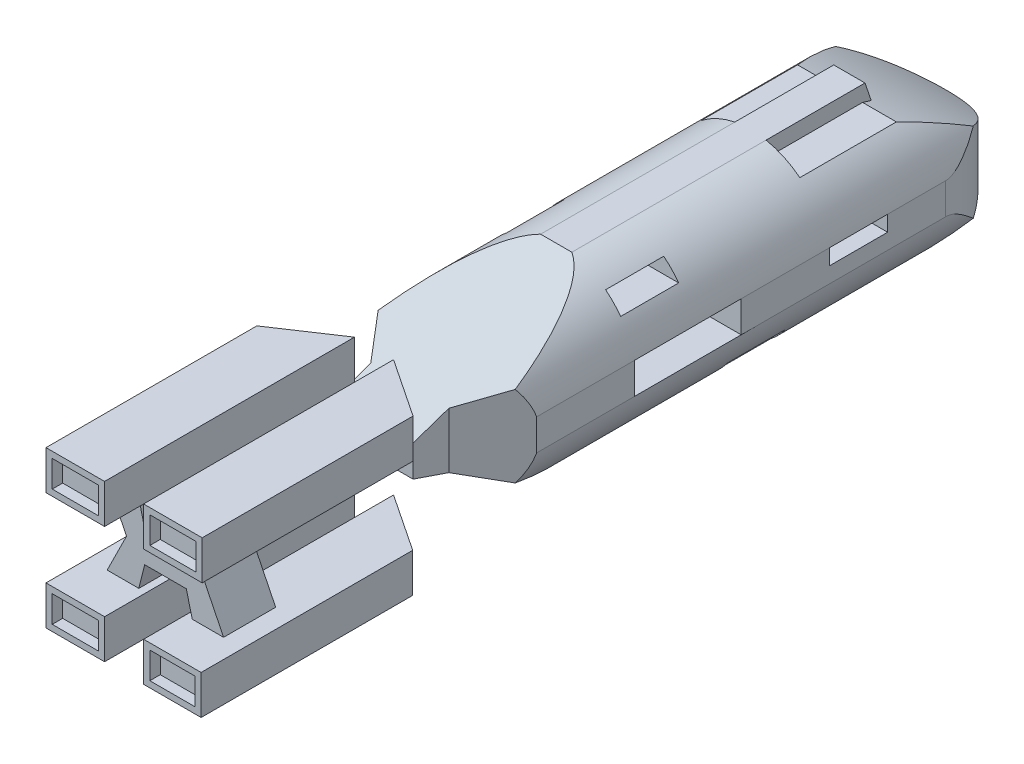
from build123d import *

# Parameters (mm, degrees)
SKETCH1_W            = 150000
SKETCH1_H            = 750000
BOSS_EXTRUDE1_DEPTH  = 150000
CUT_EXTRUDE2_DEPTH   = 430843.198490352
CUT_EXTRUDE3_DEPTH   = 410792.918128875
SKETCH5_OUTSIDE_W    = 305886.572
SKETCH5_OUTSIDE_H    = 305886.572
SKETCH5_OUTSIDE_W_2  = 56250
SKETCH5_OUTSIDE_H_2  = 37500
SKETCH5_OUTSIDE_W_3  = 55219.950582036
CUT_EXTRUDE4_DEPTH   = 200000
BOSS_EXTRUDE2_DEPTH  = 50000
BOSS_EXTRUDE3_DEPTH  = 280000
CUT_EXTRUDE5_DEPTH   = 430843.198490352
CUT_EXTRUDE7_DEPTH   = 38976
SKETCH10_OUTSIDE_W   = 305886.572
SKETCH10_OUTSIDE_H   = 305886.572
SKETCH10_OUTSIDE_R   = 76485.292703892
CUT_EXTRUDE8_DEPTH   = 496230
CUT_EXTRUDE10_DEPTH  = 40000
SKETCH14_W           = 55219.950582036
SKETCH14_H           = 37500
SKETCH14_W_2         = 56250
BOSS_EXTRUDE5_DEPTH  = 40000
CUT_EXTRUDE12_DEPTH  = 447605.736346752
SKETCH20_W           = 102625
SKETCH20_H           = 30000.000000002
SKETCH20_W_2         = 55750
SKETCH20_H_2         = 15000.000000001
CUT_EXTRUDE15_DEPTH  = 20000
SKETCH21_W           = 102625
SKETCH21_H           = 30000.000000002
CUT_EXTRUDE16_DEPTH  = 460028.17311052
SKETCH22_W           = 30000
SKETCH22_H           = 100000
BOSS_EXTRUDE8_DEPTH  = 39634
CUT_EXTRUDE17_DEPTH  = 39634
SKETCH24_W           = 55750
SKETCH24_H           = 15000
CUT_EXTRUDE18_DEPTH  = 55000
SKETCH25_W           = 45000
SKETCH25_H           = 95000
CUT_EXTRUDE19_DEPTH  = 15000
SKETCH27_W           = 65836.596516098
SKETCH27_H           = 105204.254354878
CUT_EXTRUDE22_DEPTH  = 50000
CUT_EXTRUDE24_START  = -236000
SKETCH31_W           = 44250
SKETCH31_H           = 25500
SKETCH31_W_2         = 43219.950582036
CUT_EXTRUDE24_DEPTH  = 236000
SKETCH33_W           = 44250
SKETCH33_H           = 25500
SKETCH33_W_2         = 43219.950582036
BOSS_EXTRUDE12_DEPTH = 200000
SKETCH34_W           = 44250
SKETCH34_H           = 25500
SKETCH34_W_2         = 43219.950582036
CUT_EXTRUDE25_DEPTH  = 10000
SKETCH35_W           = 30000
SKETCH35_H           = 120000
CUT_EXTRUDE26_DEPTH  = 20000
SKETCH36_R           = 5000
BOSS_EXTRUDE13_DEPTH = 67198
SKETCH37_W           = 10000
SKETCH37_H           = 10000
BOSS_EXTRUDE14_DEPTH = 11113
SKETCH38_R           = 4000
CUT_EXTRUDE27_DEPTH  = 86238
CUT_EXTRUDE28_DEPTH  = 10


with BuildPart() as part:
    # Sketch1 → Boss-Extrude1 (new body)
    with BuildSketch(Plane(origin=(0, 0, 0), x_dir=(1, 0, 0), z_dir=(0, 1, 0))):
        Rectangle(SKETCH1_W, SKETCH1_H)
    extrude(amount=BOSS_EXTRUDE1_DEPTH)

    # Sketch3 → Cut-Extrude2 (cut, through all)
    with BuildSketch(Plane(origin=(75000, 0, 0), x_dir=(0, 0, -1), z_dir=(1, 0, 0))):
        with BuildLine():
            Line((187500, 150000), (375000, 150000))
            Line((375000, 150000), (375000, 90000))
            ThreePointArc((375000, 90000), (285431.03929469, 133065.747795905), (187500, 150000))
        make_face()
        with BuildLine():
            Line((375000, 60000), (375000, 0))
            Line((375000, 0), (187500, 0))
            ThreePointArc((187500, 0), (285431.03929469, 16934.252204095), (375000, 60000))
        make_face()
    extrude(amount=-CUT_EXTRUDE2_DEPTH, mode=Mode.SUBTRACT)

    # Sketch4 → Cut-Extrude3 (cut, through all)
    with BuildSketch(Plane(origin=(0, 150000, 0), x_dir=(1, 0, 0), z_dir=(0, 1, 0))):
        Polygon((-75000, -93750), (-37500, -140625), (-37500, -187500), (-75000, -187500), align=None)
        Polygon((75000, -93750), (37500, -140625), (37500, -187500), (75000, -187500), align=None)
    extrude(amount=-CUT_EXTRUDE3_DEPTH, mode=Mode.SUBTRACT)

    # Sketch5 outside → Cut-Extrude4 (cut)
    with BuildSketch(Plane.XY.offset(375000)):
        with Locations((0, 75000)):
            Rectangle(SKETCH5_OUTSIDE_W, SKETCH5_OUTSIDE_H)
        with Locations((-46875, 131250)):
            Rectangle(SKETCH5_OUTSIDE_W_2, SKETCH5_OUTSIDE_H_2, mode=Mode.SUBTRACT)
        with Locations((46875, 131250)):
            Rectangle(SKETCH5_OUTSIDE_W_2, SKETCH5_OUTSIDE_H_2, mode=Mode.SUBTRACT)
        with Locations((-46875, 18750)):
            Rectangle(SKETCH5_OUTSIDE_W_2, SKETCH5_OUTSIDE_H_2, mode=Mode.SUBTRACT)
        with Locations((46359.975291018, 18750)):
            Rectangle(SKETCH5_OUTSIDE_W_3, SKETCH5_OUTSIDE_H_2, mode=Mode.SUBTRACT)
    extrude(amount=-CUT_EXTRUDE4_DEPTH, mode=Mode.SUBTRACT)

    # Sketch6 → Boss-Extrude2 (add)
    with BuildSketch(Plane.XY.offset(375000)):
        Polygon((60164.962936527, 28125), (37113.731468264, 75000), (60937.5, 121875), (32812.5, 140625), (19742.487645509, 90000), (-20257.512354491, 90000), (-32812.5, 140625), (-60937.5, 121875), (-37628.756177245, 75000), (-60937.5, 28125), (-32812.5, 9375), (-20257.512354491, 60000), (19742.487645509, 60000), (32554.987645509, 9375), align=None)
    extrude(amount=-BOSS_EXTRUDE2_DEPTH)

    # Sketch7 → Boss-Extrude3 (add)
    with BuildSketch(Plane.XY.offset(375000)):
        Polygon((-20257.512354491, 90000), (-37628.756177245, 75000), (-20257.512354491, 60000), (19742.487645509, 60000), (37113.731468264, 75000), (19742.487645509, 90000), align=None)
    extrude(amount=-BOSS_EXTRUDE3_DEPTH)

    # Sketch8 → Cut-Extrude5 (cut, through all)
    with BuildSketch(Plane(origin=(75000, 0, 0), x_dir=(0, 0, -1), z_dir=(1, 0, 0))):
        Polygon((0, 150000), (-175000, 90000), (-175000, 150000), align=None)
        Polygon((0, 0), (-175000, 60000), (-175000, 0), align=None)
    extrude(amount=-CUT_EXTRUDE5_DEPTH, mode=Mode.SUBTRACT)

    # Sketch9 → Cut-Extrude7 (cut)
    with BuildSketch(Plane(origin=(0, 150000, 0), x_dir=(1, 0, 0), z_dir=(0, 1, 0))):
        Polygon((-18750, -175000), (-37500, -187500), (-75000, -212500), (-75000, -175000), align=None)
        Polygon((18750, -175000), (37500, -187500), (75000, -212500), (75000, -175000), align=None)
    extrude(amount=-CUT_EXTRUDE7_DEPTH, mode=Mode.SUBTRACT)

    # Sketch10 outside → Cut-Extrude8 (cut)
    with BuildSketch(Plane(origin=(0, 0, -375000), x_dir=(-1, 0, 0), z_dir=(0, 0, -1))):
        with Locations((0, 75000)):
            Rectangle(SKETCH10_OUTSIDE_W, SKETCH10_OUTSIDE_H)
        with Locations((0, 75000)):
            Circle(SKETCH10_OUTSIDE_R, mode=Mode.SUBTRACT)
    extrude(amount=-CUT_EXTRUDE8_DEPTH, mode=Mode.SUBTRACT)

    # Sketch11 → Cut-Extrude10 (cut)
    with BuildSketch(Plane.XZ):
        Polygon((-18750, 175000), (-37500, 187500), (-75000, 212500), (-75000, 175000), align=None)
        Polygon((18750, 175000), (37500, 187500), (73969.950582036, 211813.300388024), (73969.950582036, 175000), align=None)
    extrude(amount=-CUT_EXTRUDE10_DEPTH, mode=Mode.SUBTRACT)

    # Sketch14 → Boss-Extrude5 (add)
    with BuildSketch(Plane.XY.offset(375000)):
        with Locations((46359.975291018, 18750)):
            Rectangle(SKETCH14_W, SKETCH14_H)
        with Locations((-46875, 18750)):
            Rectangle(SKETCH14_W_2, SKETCH14_H)
        with Locations((-46875, 131250)):
            Rectangle(SKETCH14_W_2, SKETCH14_H)
        with Locations((46875, 131250)):
            Rectangle(SKETCH14_W_2, SKETCH14_H)
    extrude(amount=BOSS_EXTRUDE5_DEPTH)

    # Sketch15 → Cut-Extrude12 (cut, through all)
    with BuildSketch(Plane.XZ):
        with BuildLine():
            Line((-75000, -299000), (-75000, -375000))
            Line((-75000, -375000), (75000, -375000))
            Line((75000, -375000), (75000, -299000))
            ThreePointArc((75000, -299000), (0, -374000), (-75000, -299000))
        make_face()
    extrude(amount=-CUT_EXTRUDE12_DEPTH, mode=Mode.SUBTRACT)

    # Sketch20 → Cut-Extrude15 (cut)
    with BuildSketch(Plane.ZY.offset(75000)):
        with Locations((-51312.5, 75000)):
            Rectangle(SKETCH20_W, SKETCH20_H)
        with Locations((-215375, 82500)):
            Rectangle(SKETCH20_W_2, SKETCH20_H_2)
    cut_extrude15 = extrude(amount=-CUT_EXTRUDE15_DEPTH, mode=Mode.SUBTRACT)

    # Sketch21 → Cut-Extrude16 (cut, through all)
    with BuildSketch(Plane.ZY.offset(55000)):
        with Locations((-51312.5, 75000)):
            Rectangle(SKETCH21_W, SKETCH21_H)
    extrude(amount=-CUT_EXTRUDE16_DEPTH, mode=Mode.SUBTRACT)

    # Sketch22 → Boss-Extrude8 (add)
    with BuildSketch(Plane(origin=(0, 150000, 0), x_dir=(1, 0, 0), z_dir=(0, 1, 0))):
        with Locations((0, 237500)):
            Rectangle(SKETCH22_W, SKETCH22_H)
    extrude(amount=-BOSS_EXTRUDE8_DEPTH)

    # Sketch23 → Cut-Extrude17 (cut)
    with BuildSketch(Plane.ZY.offset(15000)):
        Polygon((-287500, 132396.785524075), (-287500, 150000), (-281500, 150000), align=None)
    cut_extrude17 = extrude(amount=-CUT_EXTRUDE17_DEPTH, mode=Mode.SUBTRACT)

    # Sketch24 → Cut-Extrude18 (cut)
    with BuildSketch(Plane.ZY.offset(75000)):
        with Locations((-130500, 22499.999999999)):
            Rectangle(SKETCH24_W, SKETCH24_H)
        with Locations((-27875, 127500)):
            Rectangle(SKETCH24_W, SKETCH24_H)
    cut_extrude18 = extrude(amount=-CUT_EXTRUDE18_DEPTH, mode=Mode.SUBTRACT)

    # Mirror1: Cut-Extrude15, Cut-Extrude17, Cut-Extrude18 across plane
    add(cut_extrude15.mirror(Plane(origin=(0, 0, 0), x_dir=(0, 0, 1), z_dir=(1, 0, 0))), mode=Mode.SUBTRACT)
    add(cut_extrude17.mirror(Plane(origin=(0, 0, 0), x_dir=(0, 0, 1), z_dir=(1, 0, 0))), mode=Mode.SUBTRACT)
    add(cut_extrude18.mirror(Plane(origin=(0, 0, 0), x_dir=(0, 0, 1), z_dir=(1, 0, 0))), mode=Mode.SUBTRACT)

    # Sketch25 → Cut-Extrude19 (cut)
    with BuildSketch(Plane(origin=(0, 150000, 0), x_dir=(1, 0, 0), z_dir=(0, 1, 0))):
        with Locations((37500, 234000)):
            Rectangle(SKETCH25_W, SKETCH25_H)
        with Locations((-37500, 234000)):
            Rectangle(SKETCH25_W, SKETCH25_H)
    extrude(amount=-CUT_EXTRUDE19_DEPTH, mode=Mode.SUBTRACT)

    # Sketch27 → Cut-Extrude22 (cut)
    with BuildSketch(Plane.XZ):
        with Locations((0, 52602.127177439)):
            Rectangle(SKETCH27_W, SKETCH27_H)
    extrude(amount=-CUT_EXTRUDE22_DEPTH, mode=Mode.SUBTRACT)

    # Sketch31 → Cut-Extrude24 (cut)
    with BuildSketch(Plane.XY.offset(415000).offset(CUT_EXTRUDE24_START)):
        with Locations((-46875, 131250)):
            Rectangle(SKETCH31_W, SKETCH31_H)
        with Locations((46875, 131250)):
            Rectangle(SKETCH31_W, SKETCH31_H)
        with Locations((-46875, 18750)):
            Rectangle(SKETCH31_W, SKETCH31_H)
        with Locations((46359.975291018, 18750)):
            Rectangle(SKETCH31_W_2, SKETCH31_H)
    extrude(amount=CUT_EXTRUDE24_DEPTH, mode=Mode.SUBTRACT)

    # Sketch33 → Boss-Extrude12 (add)
    with BuildSketch(Plane.XY.offset(415000)):
        with Locations((-46875, 131250)):
            Rectangle(SKETCH33_W, SKETCH33_H)
        with Locations((46875, 131250)):
            Rectangle(SKETCH33_W, SKETCH33_H)
        with Locations((-46875, 18750)):
            Rectangle(SKETCH33_W, SKETCH33_H)
        with Locations((46359.975291018, 18750)):
            Rectangle(SKETCH33_W_2, SKETCH33_H)
    extrude(amount=-BOSS_EXTRUDE12_DEPTH)

    # Sketch34 → Cut-Extrude25 (cut)
    with BuildSketch(Plane.XY.offset(415000)):
        with Locations((-46875, 131250)):
            Rectangle(SKETCH34_W, SKETCH34_H)
        with Locations((46875, 131250)):
            Rectangle(SKETCH34_W, SKETCH34_H)
        with Locations((-46875, 18750)):
            Rectangle(SKETCH34_W, SKETCH34_H)
        with Locations((46359.975291018, 18750)):
            Rectangle(SKETCH34_W_2, SKETCH34_H)
    extrude(amount=-CUT_EXTRUDE25_DEPTH, mode=Mode.SUBTRACT)

    # Sketch35 → Cut-Extrude26 (cut)
    with BuildSketch(Plane.XZ):
        with Locations((0, -247500)):
            Rectangle(SKETCH35_W, SKETCH35_H)
    extrude(amount=-CUT_EXTRUDE26_DEPTH, mode=Mode.SUBTRACT)

    # Sketch36 → Boss-Extrude13 (add)
    with BuildSketch(Plane(origin=(0, 0, -187500), x_dir=(-1, 0, 0), z_dir=(0, 0, -1))):
        with Locations(Location((7500, 10000, 0), (0, 0, 180))):
            Circle(SKETCH36_R)
        with Locations(Location((-7500, 10000, 0), (0, 0, 180))):
            Circle(SKETCH36_R)
    extrude(amount=BOSS_EXTRUDE13_DEPTH)

    # Sketch37 → Boss-Extrude14 (add)
    with BuildSketch(Plane(origin=(0, 0, -254698), x_dir=(-1, 0, 0), z_dir=(0, 0, -1))):
        with Locations((-7500, 10000)):
            Rectangle(SKETCH37_W, SKETCH37_H)
        with Locations((7500, 10000)):
            Rectangle(SKETCH37_W, SKETCH37_H)
    extrude(amount=BOSS_EXTRUDE14_DEPTH)

    # Sketch38 → Cut-Extrude27 (cut)
    with BuildSketch(Plane(origin=(0, 0, -265811), x_dir=(-1, 0, 0), z_dir=(0, 0, -1))):
        with Locations((-7500, 10000)):
            Circle(SKETCH38_R)
        with Locations((7500, 10000)):
            Circle(SKETCH38_R)
    extrude(amount=-CUT_EXTRUDE27_DEPTH, mode=Mode.SUBTRACT)

    # Sketch39 → Cut-Extrude28 (cut)
    with BuildSketch(Plane(origin=(0, 101574.314877385, -298005.741671958), x_dir=(-1, 0, 0), z_dir=(0, 0.3226211385925829, -0.9465281828520614))):
        Polygon((11250, 44187.252373319), (3750, 44187.252373319), (7500, 41862.544193093), align=None)
        Polygon((-3750, 44187.252373319), (-11250, 44187.252373319), (-7500, 41862.544193093), align=None)
        Polygon((-3750, 41862.544193093), (0, 44187.252373319), (3750, 41862.544193093), align=None)
    extrude(amount=-CUT_EXTRUDE28_DEPTH, mode=Mode.SUBTRACT)


solid = part.part
